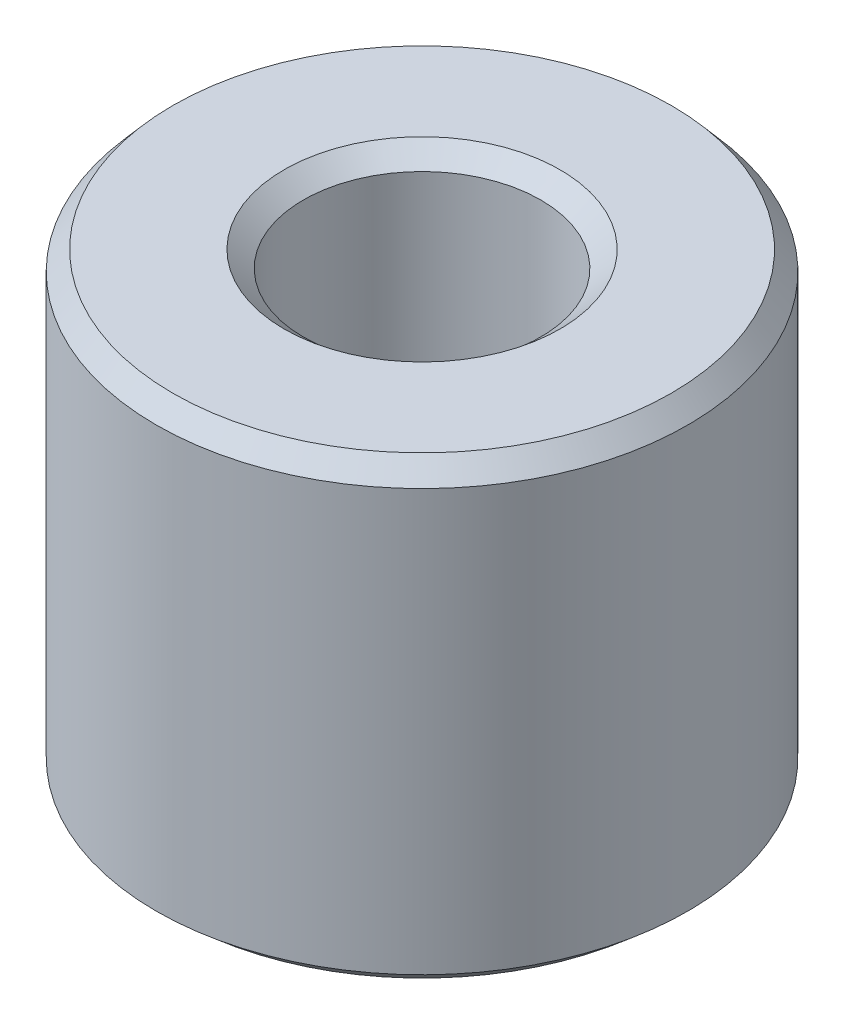
from build123d import *
from OCP.BRepFilletAPI import BRepFilletAPI_MakeChamfer

# Parameters (mm, degrees)
SKETCH1_R           = 45
BOSS_EXTRUDE1_DEPTH = 77.354326803
SKETCH2_R           = 20.100360738
CUT_EXTRUDE1_DEPTH  = 101.168317721
CHAMFER1_SIZE       = 3.263167638
CHAMFER1_SIZE2      = 2.799703209


with BuildPart() as part:
    # Sketch1 → Boss-Extrude1 (new body)
    with BuildSketch(Plane(origin=(0, 0, 0), x_dir=(1, 0, 0), z_dir=(0, 1, 0))):
        Circle(SKETCH1_R)
    extrude(amount=BOSS_EXTRUDE1_DEPTH)

    # Sketch2 → Cut-Extrude1 (cut, through all)
    with BuildSketch(Plane(origin=(0, 0, 0), x_dir=(1, 0, 0), z_dir=(0, 1, 0))):
        Circle(SKETCH2_R)
    extrude(amount=CUT_EXTRUDE1_DEPTH, mode=Mode.SUBTRACT)

    # Chamfer1: one chamfer whose edges measure the first distance from different faces: ONE call of the kernel's chamfer builder (chamfer() names one face for all edges)
    chamfer1_edges_1 = [part.edges().sort_by_distance(p)[0] for p in [
        (-20.100360738, 77.354326803, 0),
    ]]
    chamfer1_side_1 = [part.faces().sort_by_distance(p)[0] for p in [
        (-43.727207794, 77.354326803, 0),
    ]]
    chamfer1_edges_2 = [part.edges().sort_by_distance(p)[0] for p in [
        (-20.100360738, 0, 0),
    ]]
    chamfer1_side_2 = [part.faces().sort_by_distance(p)[0] for p in [
        (-20.100360738, 38.677163402, 0),
    ]]
    chamfer1_edges_3 = [part.edges().sort_by_distance(p)[0] for p in [
        (-45, 0, 0),
    ]]
    chamfer1_side_3 = [part.faces().sort_by_distance(p)[0] for p in [
        (-43.727207794, 0, 0),
    ]]
    chamfer1_edges_4 = [part.edges().sort_by_distance(p)[0] for p in [
        (-45, 77.354326803, 0),
    ]]
    chamfer1_side_4 = [part.faces().sort_by_distance(p)[0] for p in [
        (-45, 38.677163402, 0),
    ]]
    chamfer1 = BRepFilletAPI_MakeChamfer(part.part.solid().wrapped)
    for e in chamfer1_edges_1:
        chamfer1.Add(CHAMFER1_SIZE, CHAMFER1_SIZE2, e.wrapped, chamfer1_side_1[0].wrapped)  # the first distance lies on this face
    for e in chamfer1_edges_2:
        chamfer1.Add(CHAMFER1_SIZE, CHAMFER1_SIZE2, e.wrapped, chamfer1_side_2[0].wrapped)  # the first distance lies on this face
    for e in chamfer1_edges_3:
        chamfer1.Add(CHAMFER1_SIZE, CHAMFER1_SIZE2, e.wrapped, chamfer1_side_3[0].wrapped)  # the first distance lies on this face
    for e in chamfer1_edges_4:
        chamfer1.Add(CHAMFER1_SIZE, CHAMFER1_SIZE2, e.wrapped, chamfer1_side_4[0].wrapped)  # the first distance lies on this face
    add(Compound.cast(chamfer1.Shape()), mode=Mode.REPLACE)


solid = part.part
